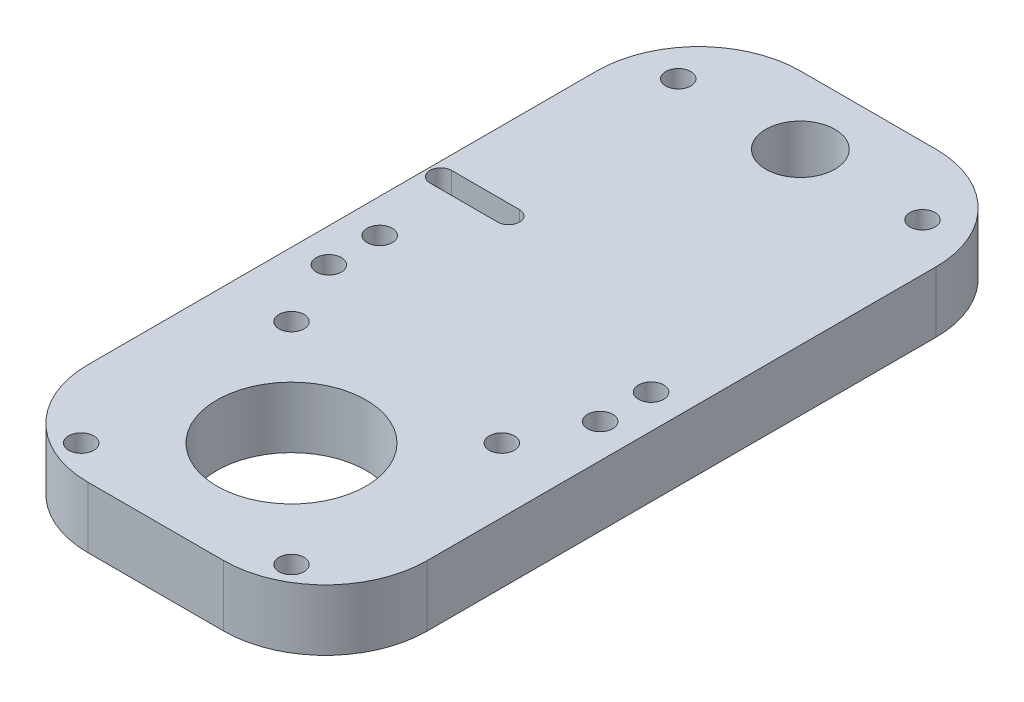
from build123d import *

# Parameters (mm, degrees)
SKETCH1_W           = 50
SKETCH1_H           = 105
BOSS_EXTRUDE1_DEPTH = 9
SKETCH2_R           = 11
SKETCH2_R_2         = 1.85
SKETCH2_R_3         = 5.1
CUT_EXTRUDE1_DEPTH  = 9
SKETCH3_R           = 1.85
CUT_EXTRUDE4_DEPTH  = 10
FILLET1_R           = 15


with BuildPart() as part:
    # Sketch1 → Boss-Extrude1 (new body)
    with BuildSketch(Plane(origin=(0, 0, 0), x_dir=(1, 0, 0), z_dir=(0, 1, 0))):
        with Locations((34.488967371, 40.084311239)):
            Rectangle(SKETCH1_W, SKETCH1_H)
    extrude(amount=BOSS_EXTRUDE1_DEPTH)

    # Sketch2 → Cut-Extrude1 (cut)
    with BuildSketch(Plane(origin=(0, 9, 0), x_dir=(1, 0, 0), z_dir=(0, 1, 0))):
        with Locations((34.488967371, 7.584311239)):
            Circle(SKETCH2_R)
        with Locations((49.988967371, 23.084311239)):
            Circle(SKETCH2_R_2)
        with Locations((18.988967371, -7.915688761)):
            Circle(SKETCH2_R_2)
        with Locations((49.988967371, -7.915688761)):
            Circle(SKETCH2_R_2)
        with Locations((18.988967371, 23.084311239)):
            Circle(SKETCH2_R_2)
        with Locations((52.488967371, 82.584311239)):
            Circle(SKETCH2_R_2)
        with Locations((34.488967371, 82.584311239)):
            Circle(SKETCH2_R_3)
        with Locations((16.488967371, 82.584311239)):
            Circle(SKETCH2_R_2)
        with BuildLine():
            Line((21.488967371, 50.984311239), (11.488967371, 50.984311239))
            ThreePointArc((11.488967371, 50.984311239), (9.888967371, 52.584311239), (11.488967371, 54.184311239))
            Line((11.488967371, 54.184311239), (21.488967371, 54.184311239))
            ThreePointArc((21.488967371, 54.184311239), (23.088967371, 52.584311239), (21.488967371, 50.984311239))
        make_face()
    extrude(amount=-CUT_EXTRUDE1_DEPTH, mode=Mode.SUBTRACT)

    # Sketch3 → Cut-Extrude4 (cut)
    with BuildSketch(Plane(origin=(0, 9, 0), x_dir=(1, 0, 0), z_dir=(0, 1, 0))):
        with Locations((14.488967371, 40.584311239)):
            Circle(SKETCH3_R)
        with Locations((54.488967371, 40.584311239)):
            Circle(SKETCH3_R)
        with Locations((54.488967371, 33.084311239)):
            Circle(SKETCH3_R)
        with Locations((14.488967371, 33.084311239)):
            Circle(SKETCH3_R)
    extrude(amount=-CUT_EXTRUDE4_DEPTH, mode=Mode.SUBTRACT)

    # Fillet1
    fillet1_edges = [part.edges().sort_by_distance(p)[0] for p in [
        (59.488967371, 4.5, 12.415688761),
        (9.488967371, 4.5, 12.415688761),
        (59.488967371, 4.5, -92.584311239),
        (9.488967371, 4.5, -92.584311239),
    ]]
    fillet(fillet1_edges, radius=FILLET1_R)


solid = part.part
